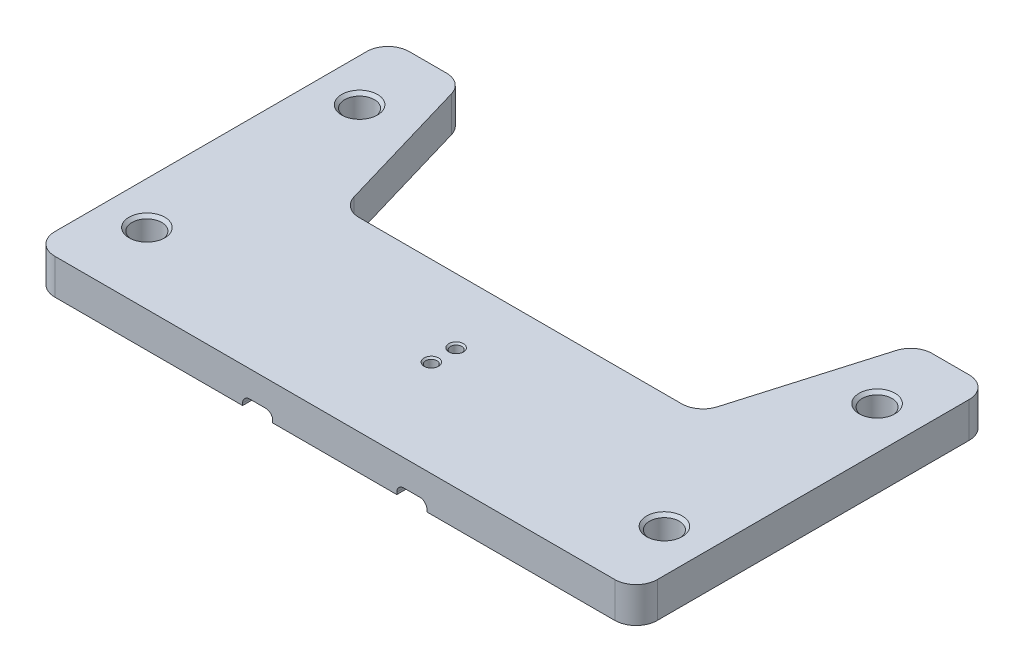
from build123d import *

# Parameters (mm, degrees)
BOSS_EXTRUDE1_DEPTH             = 5
M2X0_4_TAPPED_HOLE1_D           = 1.6
M2X0_4_TAPPED_HOLE1_DEPTH       = 7.27
M2X0_4_TAPPED_HOLE1_CSINK_D     = 2.05
M2X0_4_TAPPED_HOLE1_CSINK_ANGLE = 90
M2X0_4_TAPPED_HOLE1_TIP         = 0.480688495
M5X0_8_TAPPED_HOLE1_D           = 4.2
M5X0_8_TAPPED_HOLE1_DEPTH       = 12.4
M5X0_8_TAPPED_HOLE1_CSINK_D     = 5.05
M5X0_8_TAPPED_HOLE1_CSINK_ANGLE = 90
M5X0_8_TAPPED_HOLE1_TIP         = 1.2618073
CUT_EXTRUDE2_DEPTH              = 51.168392834
CUT_EXTRUDE2_DEPTH_BACK         = 51.168392834
SKETCH8_W                       = 4.25
SKETCH8_H                       = 1.3
CUT_EXTRUDE3_DEPTH              = 66.812232905
FILLET1_R                       = 3
FILLET2_R                       = 1


with BuildPart() as part:
    # Sketch2 → Boss-Extrude1 (new body)
    with BuildSketch(Plane(origin=(0, 0, 0), x_dir=(1, 0, 0), z_dir=(0, 1, 0))):
        Polygon((42.5, 0), (42.5, 50), (22.5, 50), (8.75, 26.184301396), (-8.75, 26.184301396), (-22.5, 50), (-42.5, 50), (-42.5, 0), align=None)
    extrude(amount=BOSS_EXTRUDE1_DEPTH)

    # M2x0.4 Tapped Hole1
    with Locations(Plane(origin=(0, 5, 0), x_dir=(1, 0, 0), z_dir=(0, 1, 0))):
        with Locations((0, 13.62), (0, 17.12)):
            CounterSinkHole(M2X0_4_TAPPED_HOLE1_D / 2, M2X0_4_TAPPED_HOLE1_CSINK_D / 2, depth=M2X0_4_TAPPED_HOLE1_DEPTH, counter_sink_angle=M2X0_4_TAPPED_HOLE1_CSINK_ANGLE)
            with Locations((0, 0, -(M2X0_4_TAPPED_HOLE1_DEPTH + M2X0_4_TAPPED_HOLE1_TIP / 2))):  # 118° drill point
                Cone(0, M2X0_4_TAPPED_HOLE1_D / 2, M2X0_4_TAPPED_HOLE1_TIP, mode=Mode.SUBTRACT)

    # M5x0.8 Tapped Hole1
    with Locations(Plane(origin=(0, 5, 0), x_dir=(1, 0, 0), z_dir=(0, 1, 0))):
        with Locations((-36.5, 40), (36.5, 40), (-36.5, 10), (36.5, 10)):
            CounterSinkHole(M5X0_8_TAPPED_HOLE1_D / 2, M5X0_8_TAPPED_HOLE1_CSINK_D / 2, depth=M5X0_8_TAPPED_HOLE1_DEPTH, counter_sink_angle=M5X0_8_TAPPED_HOLE1_CSINK_ANGLE)
            with Locations((0, 0, -(M5X0_8_TAPPED_HOLE1_DEPTH + M5X0_8_TAPPED_HOLE1_TIP / 2))):  # 118° drill point
                Cone(0, M5X0_8_TAPPED_HOLE1_D / 2, M5X0_8_TAPPED_HOLE1_TIP, mode=Mode.SUBTRACT)

    # Sketch8 → Cut-Extrude2 (cut, two sides: drawn at the far end of the back side and taken through both)
    with BuildSketch(Plane(origin=(0, 0, -26.184301396), x_dir=(-1, 0, 0), z_dir=(0, 0, -1)).offset(-CUT_EXTRUDE2_DEPTH_BACK)):
        with Locations((-10.875, 0.65)):
            Rectangle(SKETCH8_W, SKETCH8_H)
        with Locations((10.875, 0.65)):
            Rectangle(SKETCH8_W, SKETCH8_H)
    extrude(amount=CUT_EXTRUDE2_DEPTH + CUT_EXTRUDE2_DEPTH_BACK, mode=Mode.SUBTRACT)

    # Sketch9 → Cut-Extrude3 (cut, through all)
    with BuildSketch(Plane.XZ):
        Polygon((-32, -50), (-25, -26.184301396), (25, -26.184301396), (32, -50), align=None)
    extrude(amount=-CUT_EXTRUDE3_DEPTH, mode=Mode.SUBTRACT)

    # Fillet1
    fillet1_edges = [part.edges().sort_by_distance(p)[0] for p in [
        (42.5, 2.5, -50),
        (-42.5, 2.5, -50),
        (-32, 2.5, -50),
        (32, 2.5, -50),
        (25, 2.5, -26.184301396),
        (-25, 2.5, -26.184301396),
        (42.5, 2.5, 0),
        (-42.5, 2.5, 0),
    ]]
    fillet(fillet1_edges, radius=FILLET1_R)

    # Fillet2
    fillet2_edges = [part.edges().sort_by_distance(p)[0] for p in [
        (-13, 1.3, -13.092150698),
        (-8.75, 1.3, -13.092150698),
        (8.75, 1.3, -13.092150698),
        (13, 1.3, -13.092150698),
    ]]
    fillet(fillet2_edges, radius=FILLET2_R)


solid = part.part
